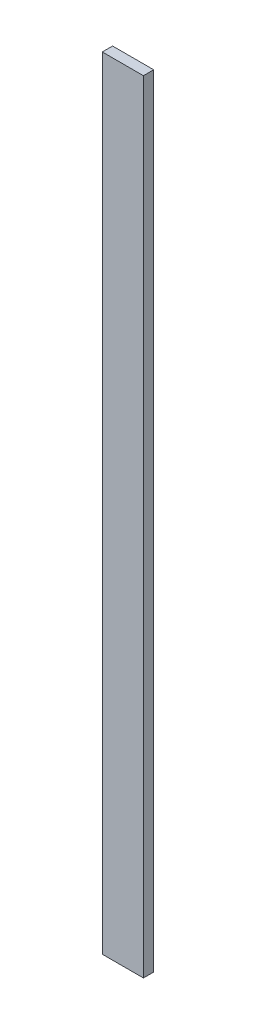
from build123d import *

# Parameters (mm, degrees)
SKETCH1_W           = 25.4
SKETCH1_H           = 482.6
BOSS_EXTRUDE1_DEPTH = 3.175


with BuildPart() as part:
    # Sketch1 → Boss-Extrude1 (new, symmetric)
    with BuildSketch(Plane.XY):
        Rectangle(SKETCH1_W, SKETCH1_H)
    extrude(amount=BOSS_EXTRUDE1_DEPTH, both=True)


solid = part.part
